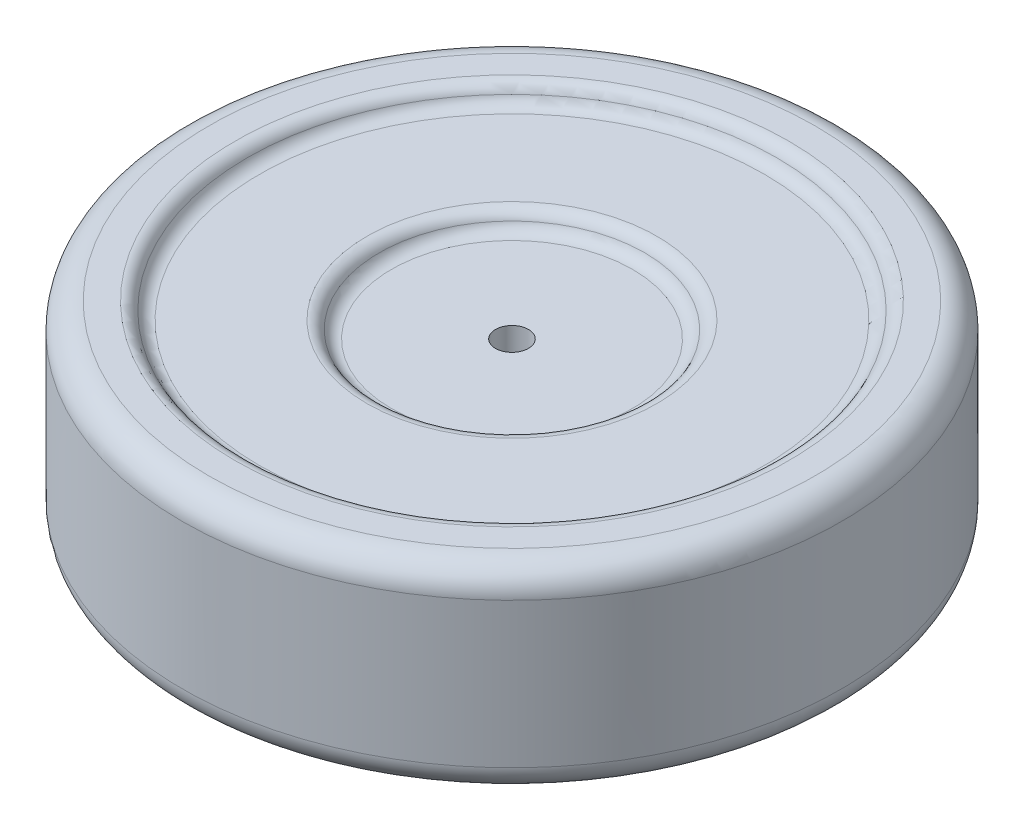
from build123d import *

# Parameters (mm, degrees)
SKETCH1_R            = 127
BOSS_EXTRUDE1_DEPTH  = 38.1
SKETCH2_R            = 101.6
CUT_EXTRUDE1_DEPTH   = 6.35
SKETCH3_R            = 50.8
CUT_EXTRUDE2_DEPTH   = 6.35
SKETCH4_R            = 6.35
CUT_EXTRUDE3_DEPTH   = 77.978
FILLET1_R            = 10.16
FILLET2_R            = 5.08
FILLET3_R            = 5.08
FILLET4_R            = 5.08
FILLET5_R            = 5.08
FILLET1_OF_MIRROR1_R = 10.16
FILLET2_OF_MIRROR1_R = 5.08
FILLET3_OF_MIRROR1_R = 5.08
FILLET4_OF_MIRROR1_R = 5.08
FILLET5_OF_MIRROR1_R = 5.08


with BuildPart() as part:
    # Sketch1 → Boss-Extrude1 (new body)
    with BuildSketch(Plane(origin=(0, 0, 0), x_dir=(1, 0, 0), z_dir=(0, 1, 0))):
        Circle(SKETCH1_R)
    boss_extrude1 = extrude(amount=BOSS_EXTRUDE1_DEPTH)

    # Sketch2 → Cut-Extrude1 (cut)
    with BuildSketch(Plane(origin=(0, 38.1, 0), x_dir=(1, 0, 0), z_dir=(0, 1, 0))):
        Circle(SKETCH2_R)
    cut_extrude1 = extrude(amount=-CUT_EXTRUDE1_DEPTH, mode=Mode.SUBTRACT)

    # Sketch3 → Cut-Extrude2 (cut)
    with BuildSketch(Plane(origin=(0, 31.75, 0), x_dir=(1, 0, 0), z_dir=(0, 1, 0))):
        Circle(SKETCH3_R)
    cut_extrude2 = extrude(amount=-CUT_EXTRUDE2_DEPTH, mode=Mode.SUBTRACT)

    # Sketch4 → Cut-Extrude3 (cut)
    with BuildSketch(Plane(origin=(0, 25.4, 0), x_dir=(1, 0, 0), z_dir=(0, 1, 0))):
        Circle(SKETCH4_R)
    cut_extrude3 = extrude(amount=-CUT_EXTRUDE3_DEPTH, mode=Mode.SUBTRACT)

    # Fillet1
    fillet1_edges = [part.edges().sort_by_distance(p)[0] for p in [
        (-127, 38.1, 0),
    ]]
    fillet(fillet1_edges, radius=FILLET1_R)

    # Fillet2
    fillet2_edges = [part.edges().sort_by_distance(p)[0] for p in [
        (-101.6, 38.1, 0),
    ]]
    fillet(fillet2_edges, radius=FILLET2_R)

    # Fillet3
    fillet3_edges = [part.edges().sort_by_distance(p)[0] for p in [
        (-101.6, 31.75, 0),
    ]]
    fillet(fillet3_edges, radius=FILLET3_R)

    # Fillet4
    fillet4_edges = [part.edges().sort_by_distance(p)[0] for p in [
        (-50.8, 31.75, 0),
    ]]
    fillet(fillet4_edges, radius=FILLET4_R)

    # Fillet5
    fillet5_edges = [part.edges().sort_by_distance(p)[0] for p in [
        (-50.8, 25.4, 0),
    ]]
    fillet(fillet5_edges, radius=FILLET5_R)

    # Mirror1: Boss-Extrude1, Cut-Extrude1, Cut-Extrude2, Cut-Extrude3 across plane
    add(boss_extrude1.mirror(Plane.ZX))
    add(cut_extrude1.mirror(Plane.ZX), mode=Mode.SUBTRACT)
    add(cut_extrude2.mirror(Plane.ZX), mode=Mode.SUBTRACT)
    add(cut_extrude3.mirror(Plane.ZX), mode=Mode.SUBTRACT)

    # Fillet1 of Mirror1
    fillet1_of_mirror1_edges = [part.edges().sort_by_distance(p)[0] for p in [
        (-127, -38.1, 0),
    ]]
    fillet(fillet1_of_mirror1_edges, radius=FILLET1_OF_MIRROR1_R)

    # Fillet2 of Mirror1
    fillet2_of_mirror1_edges = [part.edges().sort_by_distance(p)[0] for p in [
        (-101.6, -38.1, 0),
    ]]
    fillet(fillet2_of_mirror1_edges, radius=FILLET2_OF_MIRROR1_R)

    # Fillet3 of Mirror1
    fillet3_of_mirror1_edges = [part.edges().sort_by_distance(p)[0] for p in [
        (-101.6, -31.75, 0),
    ]]
    fillet(fillet3_of_mirror1_edges, radius=FILLET3_OF_MIRROR1_R)

    # Fillet4 of Mirror1
    fillet4_of_mirror1_edges = [part.edges().sort_by_distance(p)[0] for p in [
        (-50.8, -31.75, 0),
    ]]
    fillet(fillet4_of_mirror1_edges, radius=FILLET4_OF_MIRROR1_R)

    # Fillet5 of Mirror1
    fillet5_of_mirror1_edges = [part.edges().sort_by_distance(p)[0] for p in [
        (-50.8, -25.4, 0),
    ]]
    fillet(fillet5_of_mirror1_edges, radius=FILLET5_OF_MIRROR1_R)


solid = part.part
